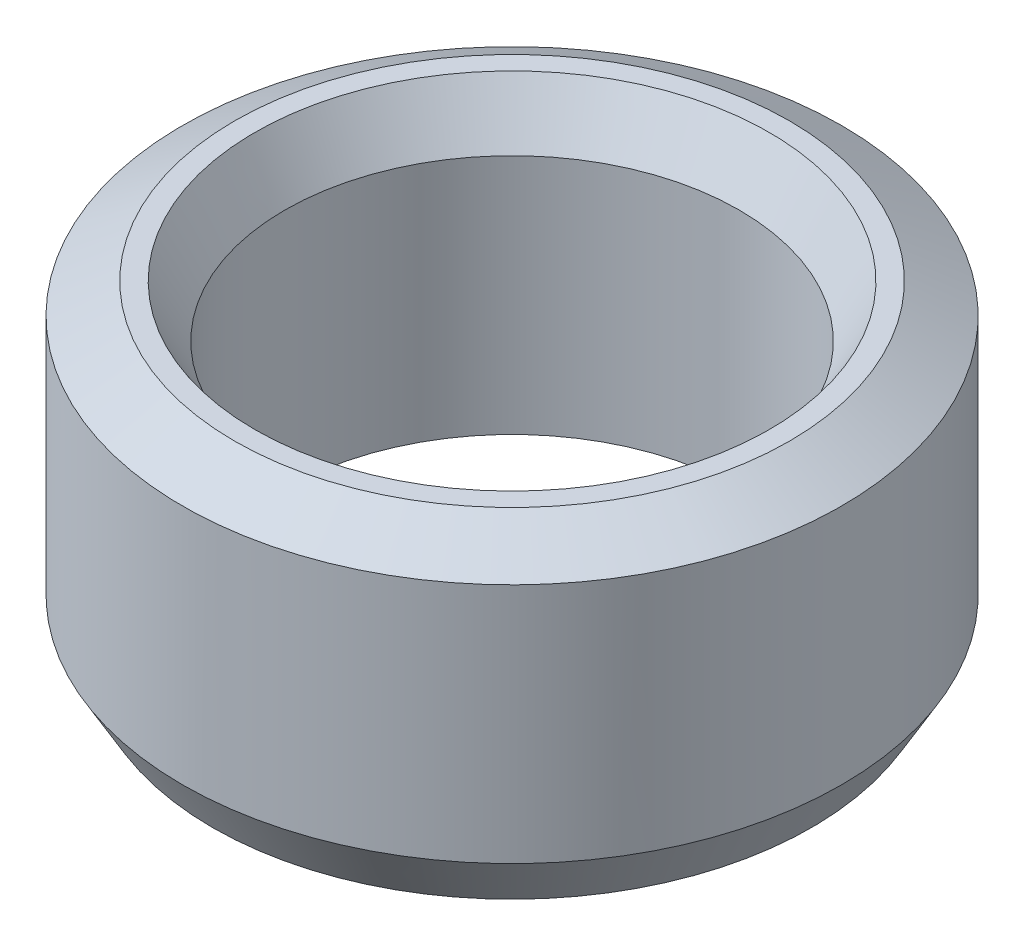
from build123d import *
from OCP.BRepFilletAPI import BRepFilletAPI_MakeChamfer

# Parameters (mm, degrees)
SKETCH1_R           = 7.5
BOSS_EXTRUDE1_DEPTH = 7.365848029
SKETCH2_R           = 5.170580622
CUT_EXTRUDE1_DEPTH  = 13.913392939
CHAMFER1_SIZE       = 0.685091076
CHAMFER1_SIZE2      = 1.186612552


with BuildPart() as part:
    # Sketch1 → Boss-Extrude1 (new body)
    with BuildSketch(Plane(origin=(0, 0, 0), x_dir=(1, 0, 0), z_dir=(0, 1, 0))):
        Circle(SKETCH1_R)
    extrude(amount=BOSS_EXTRUDE1_DEPTH)

    # Sketch2 → Cut-Extrude1 (cut, through all)
    with BuildSketch(Plane(origin=(0, 0, 0), x_dir=(1, 0, 0), z_dir=(0, 1, 0))):
        Circle(SKETCH2_R)
    extrude(amount=CUT_EXTRUDE1_DEPTH, mode=Mode.SUBTRACT)

    # Chamfer1: one chamfer whose edges measure the first distance from different faces: ONE call of the kernel's chamfer builder (chamfer() names one face for all edges)
    chamfer1_edges_1 = [part.edges().sort_by_distance(p)[0] for p in [
        (-5.170580622, 7.365848029, 0),
    ]]
    chamfer1_side_1 = [part.faces().sort_by_distance(p)[0] for p in [
        (-7.287867966, 7.365848029, 0),
    ]]
    chamfer1_edges_2 = [part.edges().sort_by_distance(p)[0] for p in [
        (-5.170580622, 0, 0),
    ]]
    chamfer1_side_2 = [part.faces().sort_by_distance(p)[0] for p in [
        (-5.170580622, 3.682924015, 0),
    ]]
    chamfer1_edges_3 = [part.edges().sort_by_distance(p)[0] for p in [
        (-7.5, 0, 0),
    ]]
    chamfer1_side_3 = [part.faces().sort_by_distance(p)[0] for p in [
        (-7.287867966, 0, 0),
    ]]
    chamfer1_edges_4 = [part.edges().sort_by_distance(p)[0] for p in [
        (-7.5, 7.365848029, 0),
    ]]
    chamfer1_side_4 = [part.faces().sort_by_distance(p)[0] for p in [
        (-7.5, 3.682924015, 0),
    ]]
    chamfer1 = BRepFilletAPI_MakeChamfer(part.part.solid().wrapped)
    for e in chamfer1_edges_1:
        chamfer1.Add(CHAMFER1_SIZE, CHAMFER1_SIZE2, e.wrapped, chamfer1_side_1[0].wrapped)  # the first distance lies on this face
    for e in chamfer1_edges_2:
        chamfer1.Add(CHAMFER1_SIZE, CHAMFER1_SIZE2, e.wrapped, chamfer1_side_2[0].wrapped)  # the first distance lies on this face
    for e in chamfer1_edges_3:
        chamfer1.Add(CHAMFER1_SIZE, CHAMFER1_SIZE2, e.wrapped, chamfer1_side_3[0].wrapped)  # the first distance lies on this face
    for e in chamfer1_edges_4:
        chamfer1.Add(CHAMFER1_SIZE, CHAMFER1_SIZE2, e.wrapped, chamfer1_side_4[0].wrapped)  # the first distance lies on this face
    add(Compound.cast(chamfer1.Shape()), mode=Mode.REPLACE)


solid = part.part
